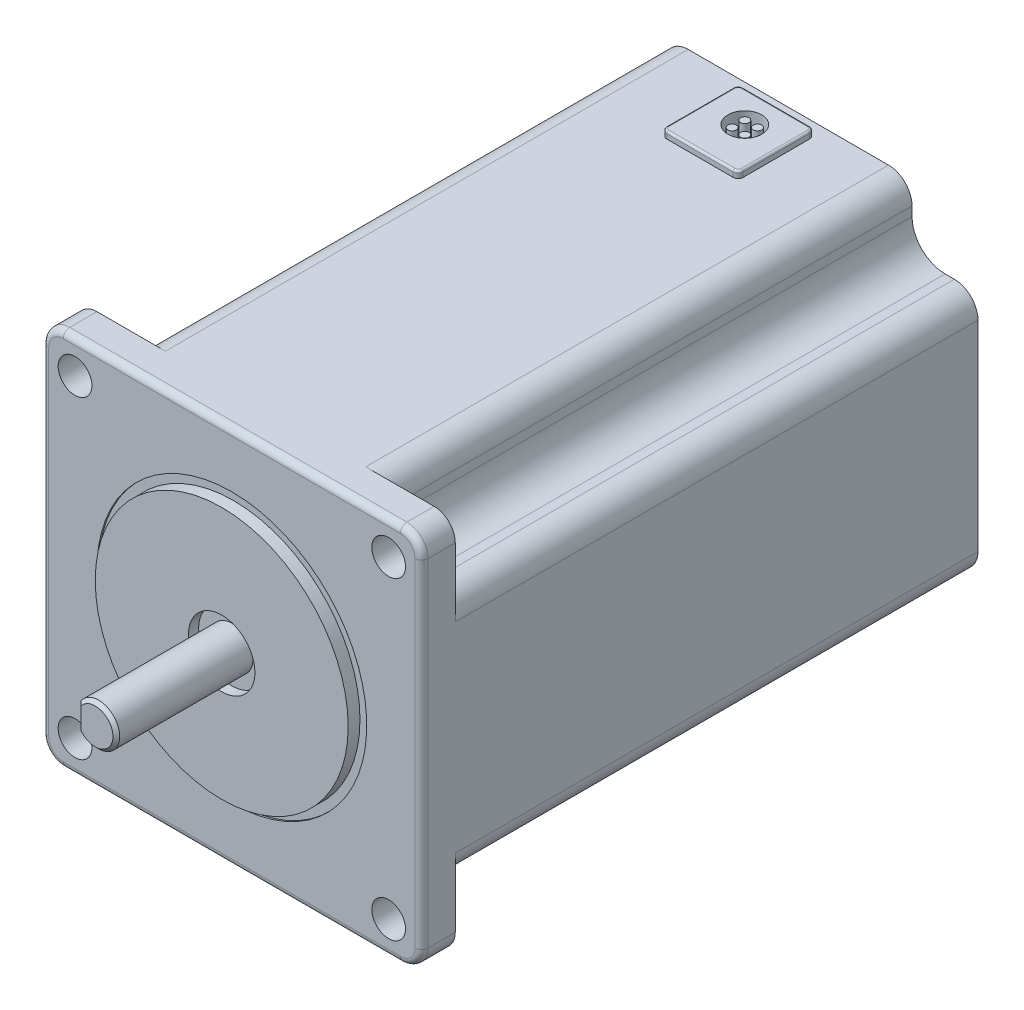
from build123d import *

# Parameters (mm, degrees)
BOSS_EXTRUDE1_DEPTH = 5.08
FILLET1_R           = 0.9906
BOSS_EXTRUDE2_DEPTH = 78.74
SKETCH5_W           = 1.524
SKETCH5_H           = 19.05
SKETCH6_W           = 0.254
SKETCH6_H           = 1.27
SKETCH7_W           = 99.314
SKETCH7_H           = 3.175
CUT_EXTRUDE1_START  = -14.986
CUT_EXTRUDE1_DEPTH  = 14.986
CHAMFER1_SIZE       = 0.508
SKETCH9_R           = 2.54
CUT_EXTRUDE2_DEPTH  = 5.08
CUT_EXTRUDE3_DEPTH  = 1.2954
SKETCH11_R          = 3.7465
SKETCH11_R_2        = 2.54
BOSS_EXTRUDE3_DEPTH = 1.2954
SKETCH12_W          = 11.5062
SKETCH12_H          = 11.5062
SKETCH12_R          = 2.54
BOSS_EXTRUDE4_DEPTH = 1.016
FILLET2_R           = 0.762
FILLET3_R           = 0.3048
SKETCH13_R          = 0.635
BOSS_EXTRUDE5_DEPTH = 1.9304


with BuildPart() as part:
    # Sketch3 → Boss-Extrude1 (new body)
    with BuildSketch(Plane.XY):
        with BuildLine():
            Line((-28.575, -25.4), (-28.575, 25.4))
            ThreePointArc((-28.575, 25.4), (-27.64506403, 27.64506403), (-25.4, 28.575))
            Line((-25.4, 28.575), (25.4, 28.575))
            ThreePointArc((25.4, 28.575), (27.64506403, 27.64506403), (28.575, 25.4))
            Line((28.575, 25.4), (28.575, -25.4))
            ThreePointArc((28.575, -25.4), (27.64506403, -27.64506403), (25.4, -28.575))
            Line((25.4, -28.575), (-25.4, -28.575))
            ThreePointArc((-25.4, -28.575), (-27.64506403, -27.64506403), (-28.575, -25.4))
        make_face()
    extrude(amount=-BOSS_EXTRUDE1_DEPTH)

    # Fillet1
    fillet1_edges = [part.edges().sort_by_distance(p)[0] for p in [
        (-28.575, 0, 0),
        (-27.64506403, 27.64506403, 0),
        (0, 28.575, 0),
        (27.64506403, 27.64506403, 0),
        (28.575, 0, 0),
        (27.64506403, -27.64506403, 0),
        (0, -28.575, 0),
        (-27.64506403, -27.64506403, 0),
    ]]
    fillet(fillet1_edges, radius=FILLET1_R)

    # Sketch4 → Boss-Extrude2 (add)
    with BuildSketch(Plane.XY.offset(-5.08)):
        with BuildLine():
            Line((-25.019, 18.6436), (-23.622, 18.6436))
            ThreePointArc((-23.622, 18.6436), (-20.101739601, 20.101739601), (-18.6436, 23.622))
            Line((-18.6436, 23.622), (-18.6436, 25.019))
            ThreePointArc((-18.6436, 25.019), (-17.602071714, 27.533471714), (-15.0876, 28.575))
            Line((-15.0876, 28.575), (15.0876, 28.575))
            ThreePointArc((15.0876, 28.575), (17.602071714, 27.533471714), (18.6436, 25.019))
            Line((18.6436, 25.019), (18.6436, 23.622))
            ThreePointArc((18.6436, 23.622), (20.101739601, 20.101739601), (23.622, 18.6436))
            Line((23.622, 18.6436), (25.019, 18.6436))
            ThreePointArc((25.019, 18.6436), (27.533471714, 17.602071714), (28.575, 15.0876))
            Line((28.575, 15.0876), (28.575, -15.0876))
            ThreePointArc((28.575, -15.0876), (27.533471714, -17.602071714), (25.019, -18.6436))
            Line((25.019, -18.6436), (23.622, -18.6436))
            ThreePointArc((23.622, -18.6436), (20.101739601, -20.101739601), (18.6436, -23.622))
            Line((18.6436, -23.622), (18.6436, -25.019))
            ThreePointArc((18.6436, -25.019), (17.602071714, -27.533471714), (15.0876, -28.575))
            Line((15.0876, -28.575), (-15.0876, -28.575))
            ThreePointArc((-15.0876, -28.575), (-17.602071714, -27.533471714), (-18.6436, -25.019))
            Line((-18.6436, -25.019), (-18.6436, -23.622))
            ThreePointArc((-18.6436, -23.622), (-20.101739601, -20.101739601), (-23.622, -18.6436))
            Line((-23.622, -18.6436), (-25.019, -18.6436))
            ThreePointArc((-25.019, -18.6436), (-27.533471714, -17.602071714), (-28.575, -15.0876))
            Line((-28.575, -15.0876), (-28.575, 15.0876))
            ThreePointArc((-28.575, 15.0876), (-27.533471714, 17.602071714), (-25.019, 18.6436))
        make_face()
    extrude(amount=-BOSS_EXTRUDE2_DEPTH)

    # Sketch5 → Revolve1 (revolve)
    with BuildSketch(Plane(origin=(0, 0, 0), x_dir=(0, 0, -1), z_dir=(1, 0, 0))):
        with Locations((-0.762, 9.525)):
            Rectangle(SKETCH5_W, SKETCH5_H)
    revolve(axis=Axis((0, 0, 0), (0, 0, 1)))

    # Sketch6 → Cut-Revolve1 (revolve, cut)
    with BuildSketch(Plane(origin=(0, 0, 0), x_dir=(0, 0, -1), z_dir=(1, 0, 0)), mode=Mode.PRIVATE) as cut_revolve1_sk:
        Polygon((78.74, 0), (-1.524, 0), (-1.524, 4.99999), (0, 4.99999), (0, 3.175), (78.74, 3.175), align=None)
        with Locations((0.127, 19.685)):
            Rectangle(SKETCH6_W, SKETCH6_H)
    revolve(cut_revolve1_sk.sketch.rotate(Axis((0, 0, 20.574), (0, 0, -1)), 180), axis=Axis((0, 0, 20.574), (0, 0, -1)), mode=Mode.SUBTRACT)

    # Sketch9 → Cut-Extrude2 (cut)
    with BuildSketch(Plane.XY):
        with Locations((23.622, -23.622)):
            Circle(SKETCH9_R)
        with Locations((-23.622, -23.622)):
            Circle(SKETCH9_R)
        with Locations((-23.622, 23.622)):
            Circle(SKETCH9_R)
        with Locations((23.622, 23.622)):
            Circle(SKETCH9_R)
    extrude(amount=-CUT_EXTRUDE2_DEPTH, mode=Mode.SUBTRACT)

    # Sketch10 → Cut-Extrude3 (cut)
    with BuildSketch(Plane(origin=(0, 28.575, -0.751200197), x_dir=(1, 0, 0), z_dir=(0, 1, 0))):
        with BuildLine():
            Line((-3.8354, 76.520679803), (-3.8354, 71.567679803))
            Line((-3.8354, 71.567679803), (3.8354, 71.567679803))
            Line((3.8354, 71.567679803), (3.8354, 76.520679803))
            ThreePointArc((3.8354, 76.520679803), (0, 80.356079803), (-3.8354, 76.520679803))
        make_face()
    extrude(amount=-CUT_EXTRUDE3_DEPTH, mode=Mode.SUBTRACT)

    # Sketch11 → Boss-Extrude3 (add)
    with BuildSketch(Plane(origin=(0, 27.2796, 0), x_dir=(1, 0, 0), z_dir=(0, 1, 0))):
        with Locations(Location((0, 77.27188, 0), (0, 0, 270))):
            Circle(SKETCH11_R)
        with Locations(Location((0, 77.27188, 0), (0, 0, 270))):
            Circle(SKETCH11_R_2, mode=Mode.SUBTRACT)
    extrude(amount=BOSS_EXTRUDE3_DEPTH)

    # Sketch12 → Boss-Extrude4 (add)
    with BuildSketch(Plane(origin=(0, 28.575, 0), x_dir=(1, 0, 0), z_dir=(0, 1, 0))):
        with Locations((0, 76.26858)):
            Rectangle(SKETCH12_W, SKETCH12_H)
        with Locations(Location((0, 77.27188, 0), (0, 0, 270))):
            Circle(SKETCH12_R, mode=Mode.SUBTRACT)
    extrude(amount=BOSS_EXTRUDE4_DEPTH)

    # Fillet2
    fillet2_edges = [part.edges().sort_by_distance(p)[0] for p in [
        (5.7531, 29.083, -70.51548),
        (5.7531, 29.083, -82.02168),
        (-5.7531, 29.083, -82.02168),
        (-5.7531, 29.083, -70.51548),
    ]]
    fillet(fillet2_edges, radius=FILLET2_R)

    # Fillet3
    fillet3_edges = [part.edges().sort_by_distance(p)[0] for p in [
        (0, 29.591, -82.02168),
        (5.7531, 29.591, -76.26858),
        (-5.7531, 29.591, -76.26858),
        (0, 29.591, -70.51548),
        (-5.529915367, 29.591, -70.738664633),
        (5.529915367, 29.591, -70.738664633),
        (-5.529915367, 29.591, -81.798495367),
        (5.529915367, 29.591, -81.798495367),
    ]]
    fillet(fillet3_edges, radius=FILLET3_R)

    # Sketch13 → Boss-Extrude5 (add)
    with BuildSketch(Plane(origin=(0, 27.2796, 0), x_dir=(1, 0, 0), z_dir=(0, 1, 0))):
        with Locations(Location((-0.9525, 78.22438, 0), (0, 0, 270))):
            Circle(SKETCH13_R)
        with Locations(Location((0.9525, 78.22438, 0), (0, 0, 270))):
            Circle(SKETCH13_R)
        with Locations(Location((0.9525, 76.31938, 0), (0, 0, 270))):
            Circle(SKETCH13_R)
        with Locations(Location((-0.9525, 76.31938, 0), (0, 0, 270))):
            Circle(SKETCH13_R)
    extrude(amount=BOSS_EXTRUDE5_DEPTH)


with BuildPart() as body_2:
    # Sketch7 → Revolve2 (revolve)
    with BuildSketch(Plane(origin=(0, 0, 0), x_dir=(0, 0, -1), z_dir=(1, 0, 0)), mode=Mode.PRIVATE) as revolve2_sk:
        with Locations((29.083, 1.5875)):
            Rectangle(SKETCH7_W, SKETCH7_H)
    revolve(revolve2_sk.sketch.rotate(Axis((0, 0, 20.574), (0, 0, -1)), 180), axis=Axis((0, 0, 20.574), (0, 0, -1)))

    # Sketch8 → Cut-Extrude1 (cut)
    with BuildSketch(Plane.XY.offset(20.574).offset(CUT_EXTRUDE1_START)):
        with BuildLine():
            Line((-2.667, -1.722711816), (-2.667, 1.722711816))
            ThreePointArc((-2.667, 1.722711816), (-3.175, 0), (-2.667, -1.722711816))
        make_face()
    extrude(amount=CUT_EXTRUDE1_DEPTH, mode=Mode.SUBTRACT)

    # Chamfer1
    chamfer1_edges = [body_2.edges().sort_by_distance(p)[0] for p in [
        (-2.667, 0, 20.574),
        (0, 3.175, -78.74),
        (2.78838977, 1.51838977, 20.574),
    ]]
    chamfer(chamfer1_edges, length=CHAMFER1_SIZE - 0.0001)  # a hair under: the kernel refuses the full size


solid = Compound([part.part, body_2.part])
